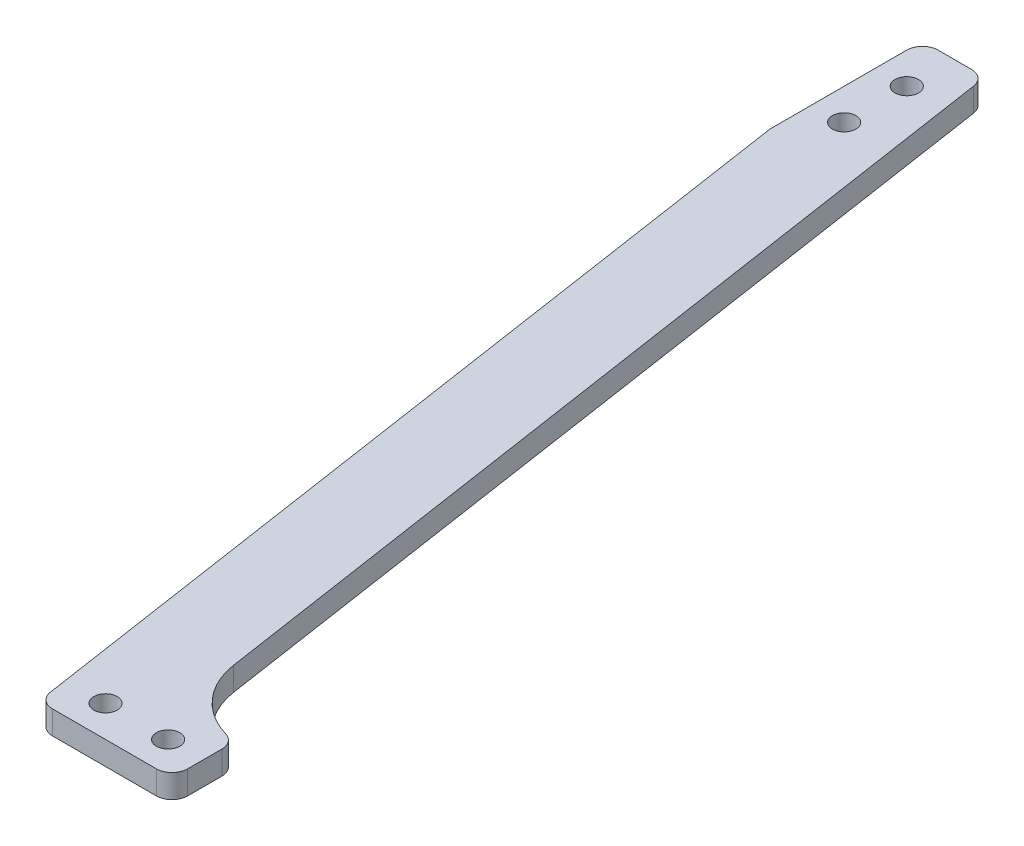
from build123d import *

# Parameters (mm, degrees)
SKETCH_1_R      = 1.5
EXTRUDE_1_DEPTH = 3
FILLET_1_R      = 10
FILLET_2_R      = 2
FILLET_3_R      = 2


with BuildPart() as part:
    # 草图1 → 凸台-拉伸1 (new body)
    with BuildSketch(Plane(origin=(0, 0, 0), x_dir=(1, 0, 0), z_dir=(0, 1, 0))):
        Polygon((0, 110), (0, 129.5), (8, 129.5), (26.335454545, 8), (33.6, 8), (33.6, 0), (16.6, 0), align=None)
        with Locations(Location((21.1, 4, 0), (0, 0, 270))):
            Circle(SKETCH_1_R, mode=Mode.SUBTRACT)
        with Locations(Location((29.1, 4, 0), (0, 0, 270))):
            Circle(SKETCH_1_R, mode=Mode.SUBTRACT)
        with Locations(Location((4, 115.5, 0), (0, 0, 270))):
            Circle(SKETCH_1_R, mode=Mode.SUBTRACT)
        with Locations(Location((4, 123.5, 0), (0, 0, 270))):
            Circle(SKETCH_1_R, mode=Mode.SUBTRACT)
    extrude(amount=EXTRUDE_1_DEPTH)

    # 圆角1
    # the kernel refuses this fillet: 10 mm, written as the material it adds along each edge
    with BuildSketch(Plane(origin=(26.335454545, 0, -8), x_dir=(-0.1492195266498612, 0, -0.9888040922581132), z_dir=(0, 1, 0))) as fillet_1_piece_1:
        with BuildLine():
            CenterArc((8.51107561, -10), FILLET_1_R, 90, 73.639575316)
            Line((-1.084012034, -7.183212274), (-1.275913787, -7.126876519))
            ThreePointArc((-1.275913787, -7.126876519), (-0.739766835, -3.561762232), (-0.197760818, 0.029843905))
            Line((-0.197760818, 0.029843905), (0, 0.2))
            Line((0, 0.2), (8.51107561, 0.2))
            Line((8.51107561, 0.2), (8.51107561, 0))
        make_face()
    extrude(amount=3)

    # 圆角2
    fillet_2_edges = [part.edges().sort_by_distance(p)[0] for p in [
        (0, 1.5, -129.5),
        (8, 1.5, -129.5),
        (33.6, 1.5, 0),
        (16.6, 1.5, 0),
    ]]
    fillet(fillet_2_edges, radius=FILLET_2_R)

    # 圆角3
    fillet_3_edges = [part.edges().sort_by_distance(p)[0] for p in [
        (33.6, 1.5, -8),
    ]]
    fillet(fillet_3_edges, radius=FILLET_3_R)


solid = part.part
